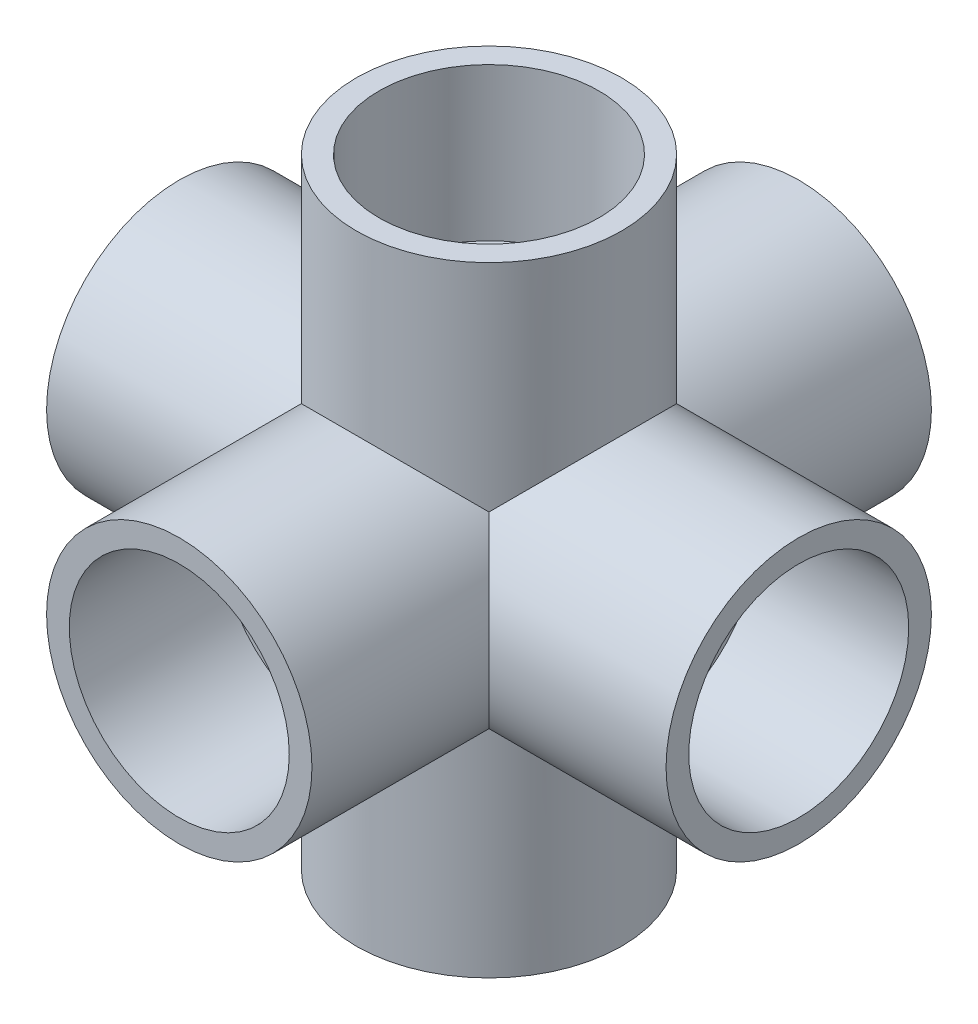
from build123d import *
from OCP.BRepAlgoAPI import BRepAlgoAPI_Cut
from OCP.TopTools import TopTools_ListOfShape
from build123d.topology import SkipClean

# Parameters (mm, degrees)
SKETCH_1_R                = 19.3
SKETCH_1_R_2              = 13.6
EXTRUDE_1_DEPTH           = 45.05
SKETCH_3_R                = 19.3
SKETCH_3_R_2              = 13.6
EXTRUDE_3_DEPTH           = 45.05
SKETCH_2_R                = 19.3
SKETCH_2_R_2              = 13.6
EXTRUDE_2_DEPTH           = 45.05
CUT_EXTRUDE_1_DEPTH       = 79.028889054
CUT_EXTRUDE_1_DEPTH_BACK  = 79.028889054
SKETCH_1_13_R             = 13.6
CUT_EXTRUDE_START         = -45.0500001
CUT_EXTRUDE_2_OUTLINE_R   = 13.6
CUT_EXTRUDE_2_DEPTH       = 90.1000002
CUT_EXTRUDE_3_DEPTH       = 79.028889054
CUT_EXTRUDE_3_DEPTH_BACK  = 124.078889054
CUT_EXTRUDE_3_START       = 45.05
SKETCH_2_8_R              = 13.6
CUT_EXTRUDE_START_2       = -45.05
SKETCH_1_15_R             = 16
CUT_EXTRUDE_4_DEPTH       = 22.2
CUT_EXTRUDE_START_3       = 45.05
SKETCH_1_16_R             = 16
CUT_EXTRUDE_5_DEPTH       = 22.2
SKETCH_3_9_R              = 16
CUT_EXTRUDE_6_DEPTH       = 22.2
SKETCH_3_10_R             = 16
CUT_EXTRUDE_7_DEPTH       = 22.2
CUT_EXTRUDE_START_4       = 22.85
CUT_EXTRUDE_8_OUTLINE_R   = 16
CUT_EXTRUDE_8_OUTLINE_R_2 = 13.6
CUT_EXTRUDE_8_DEPTH       = 22.2


with BuildPart() as part:
    # 草图1 → 凸台-拉伸1 (new, symmetric)
    with BuildSketch(Plane(origin=(0, 0, 0), x_dir=(1, 0, 0), z_dir=(0, 1, 0))):
        with Locations(Location((0, 0, 0), (0, 0, 270))):
            Circle(SKETCH_1_R)
        with Locations(Location((0, 0, 0), (0, 0, 270))):
            Circle(SKETCH_1_R_2, mode=Mode.SUBTRACT)
    extrude(amount=EXTRUDE_1_DEPTH, both=True)

    # 草图3 → 凸台-拉伸3 (add, symmetric)
    with BuildSketch(Plane(origin=(0, 0, 0), x_dir=(0, 0, -1), z_dir=(1, 0, 0))):
        with Locations(Location((0, 0, 0), (0, 0, 135))):
            Circle(SKETCH_3_R)
        with Locations(Location((0, 0, 0), (0, 0, 135.000001563))):
            Circle(SKETCH_3_R_2, mode=Mode.SUBTRACT)
    extrude(amount=EXTRUDE_3_DEPTH, both=True)

    # 草图2 → 凸台-拉伸2 (add, symmetric)
    with BuildSketch(Plane.XY):
        with Locations(Location((0, 0, 0), (0, 0, 225))):
            Circle(SKETCH_2_R)
        with Locations(Location((0, 0, 0), (0, 0, 224.999996387))):
            Circle(SKETCH_2_R_2, mode=Mode.SUBTRACT)
    extrude(amount=EXTRUDE_2_DEPTH, both=True)

    # 草图1<13> → 切除-拉伸1 (cut, two sides: drawn at the far end of the back side and taken through both)
    with BuildSketch(Plane(origin=(0, 0, 0), x_dir=(1, 0, 0), z_dir=(0, 1, 0)).offset(-CUT_EXTRUDE_1_DEPTH_BACK)):
        with Locations(Location((0, 0, 0), (0, 0, 270))):
            Circle(SKETCH_1_13_R)
    extrude(amount=CUT_EXTRUDE_1_DEPTH + CUT_EXTRUDE_1_DEPTH_BACK, mode=Mode.SUBTRACT)

    # 切除-拉伸2: read off the stored shape, not the designer's step
    # 切除-拉伸2 outline → 切除-拉伸2 (cut)
    with BuildSketch(Plane(origin=(0, 0, 0), x_dir=(0, 0, -1), z_dir=(1, 0, 0)).offset(CUT_EXTRUDE_START)):
        Circle(CUT_EXTRUDE_2_OUTLINE_R)
    extrude(amount=CUT_EXTRUDE_2_DEPTH, mode=Mode.SUBTRACT)

    # 草图2<8> → 切除-拉伸3 (cut, two sides: drawn at the far end of the back side and taken through both)
    with BuildSketch(Plane.XY.offset(CUT_EXTRUDE_3_START - CUT_EXTRUDE_3_DEPTH_BACK)):
        with Locations(Location((0, 0, 0), (0, 0, 225))):
            Circle(SKETCH_2_8_R)
    extrude(amount=CUT_EXTRUDE_3_DEPTH + CUT_EXTRUDE_3_DEPTH_BACK, mode=Mode.SUBTRACT)


with BuildPart() as cut_extrude_3_kept_piece:
    # of the separate pieces the step leaves, the one the design keeps (cut_extrude_3_pieces_kept)
    add(part.part.solids().sort_by_distance((0, -45.05, 19.3))[0])

    # 草图1<15> → 切除-拉伸4 (cut)
    with SkipClean():  # the faces are left unmerged after this step: merging them gives an invalid solid
        with BuildSketch(Plane(origin=(0, 0, 0), x_dir=(1, 0, 0), z_dir=(0, 1, 0)).offset(CUT_EXTRUDE_START_2)):
            with Locations(Location((0, 0, 0), (0, 0, 270))):
                Circle(SKETCH_1_15_R)
        extrude(amount=CUT_EXTRUDE_4_DEPTH, mode=Mode.SUBTRACT)

    # 草图1<16> → 切除-拉伸5 (cut)
    with SkipClean():  # the faces are left unmerged after this step: merging them gives an invalid solid
        with BuildSketch(Plane(origin=(0, 0, 0), x_dir=(1, 0, 0), z_dir=(0, 1, 0)).offset(CUT_EXTRUDE_START_3)):
            with Locations(Location((0, 0, 0), (0, 0, 270))):
                Circle(SKETCH_1_16_R)
        extrude(amount=-CUT_EXTRUDE_5_DEPTH, mode=Mode.SUBTRACT)

    # 草图3<9> → 切除-拉伸6 (cut)
    with SkipClean():  # the faces are left unmerged after this step: merging them gives an invalid solid
        with BuildSketch(Plane(origin=(0, 0, 0), x_dir=(0, 0, -1), z_dir=(1, 0, 0)).offset(CUT_EXTRUDE_START_2)):
            Circle(SKETCH_3_9_R)
        extrude(amount=CUT_EXTRUDE_6_DEPTH, mode=Mode.SUBTRACT)

    # 草图3<10> → 切除-拉伸7 (cut)
    with SkipClean():  # the faces are left unmerged after this step: merging them gives an invalid solid
        with BuildSketch(Plane(origin=(0, 0, 0), x_dir=(0, 0, -1), z_dir=(1, 0, 0)).offset(CUT_EXTRUDE_START_3)):
            Circle(SKETCH_3_10_R)
        extrude(amount=-CUT_EXTRUDE_7_DEPTH, mode=Mode.SUBTRACT)


with BuildPart() as cut_extrude_8_tool:
    # 切除-拉伸8: read off the stored shape, not the designer's step
    # 切除-拉伸8 outline → 切除-拉伸8 (new body)
    with BuildSketch(Plane.XY.offset(CUT_EXTRUDE_START_4)):
        Circle(CUT_EXTRUDE_8_OUTLINE_R)
        Circle(CUT_EXTRUDE_8_OUTLINE_R_2, mode=Mode.SUBTRACT)
    extrude(amount=CUT_EXTRUDE_8_DEPTH)


with BuildPart() as cut_extrude_3_kept_piece_1:
    add(cut_extrude_3_kept_piece.part)

    # 切除-拉伸8: cut by cut_extrude_8_tool, with a tolerance
    cut_extrude_8_stock = TopTools_ListOfShape()
    cut_extrude_8_stock.Append(cut_extrude_3_kept_piece_1.part.wrapped)
    cut_extrude_8_tools = TopTools_ListOfShape()
    cut_extrude_8_tools.Append(cut_extrude_8_tool.part.wrapped)
    cut_extrude_8_cut = BRepAlgoAPI_Cut()
    cut_extrude_8_cut.SetArguments(cut_extrude_8_stock)
    cut_extrude_8_cut.SetTools(cut_extrude_8_tools)
    cut_extrude_8_cut.SetFuzzyValue(0.00001)
    cut_extrude_8_cut.Build()
    add(Compound.cast(cut_extrude_8_cut.Shape()).solids(), mode=Mode.REPLACE)


solid = cut_extrude_3_kept_piece_1.part
